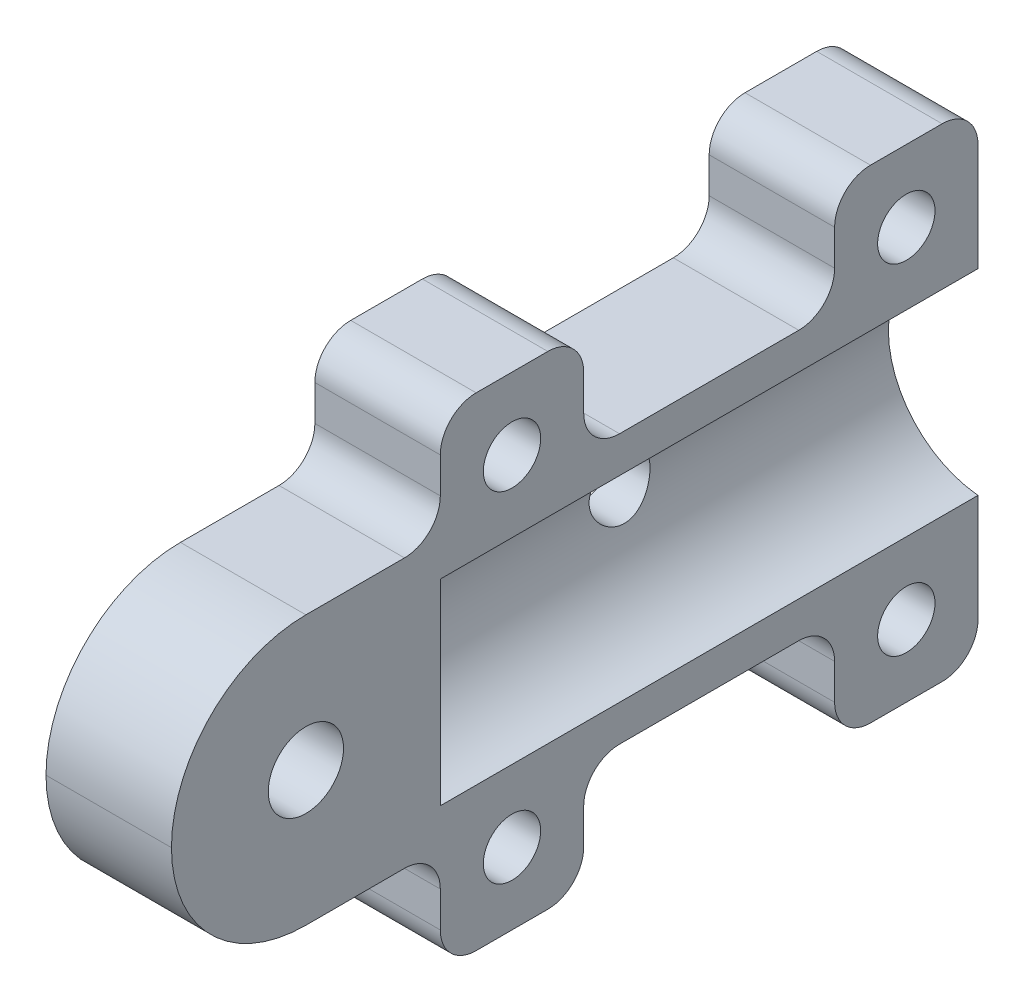
from build123d import *

# Parameters (mm, degrees)
SKETCH_1_W          = 15
SKETCH_1_H          = 15
SKETCH_1_R          = 5.5
EXTRUDE_1_DEPTH     = 45
SKETCH_5_W          = 15
SKETCH_5_H          = 15
EXTRUDE_3_DEPTH     = 15
FILLET_2_R          = 7.5
SKETCH_6_R          = 2.1
CUT_EXTRUDE_1_DEPTH = 49.023431781
CUT_EXTRUDE_2_DEPTH = 8
SKETCH_9_W          = 8
SKETCH_9_H          = 8
SKETCH_9_R          = 1.6
EXTRUDE_4_DEPTH     = 7
FILLET_3_R          = 2
SKETCH_11_R         = 3.2
CUT_EXTRUDE_3_DEPTH = 3.75
SKETCH_12_R         = 1.7
CUT_EXTRUDE_4_DEPTH = 10


with BuildPart() as part:
    # ｽｹｯﾁ1 → ﾎﾞｽ - 押し出し1 (new body)
    with BuildSketch(Plane.XY):
        Rectangle(SKETCH_1_W, SKETCH_1_H)
        with Locations(Location((0, 0, 0), (0, 0, 180))):
            Circle(SKETCH_1_R, mode=Mode.SUBTRACT)
    extrude(amount=EXTRUDE_1_DEPTH)

    # ｽｹｯﾁ5 → ﾎﾞｽ - 押し出し3 (add)
    with BuildSketch(Plane.XY.offset(45)):
        Rectangle(SKETCH_5_W, SKETCH_5_H)
    extrude(amount=-EXTRUDE_3_DEPTH)

    # ﾌｨﾚｯﾄ2
    fillet_2_edges = [part.edges().sort_by_distance(p)[0] for p in [
        (0, -7.5, 45),
        (0, 7.5, 45),
    ]]
    fillet(fillet_2_edges, radius=FILLET_2_R - 0.0001)  # a hair under: the kernel refuses the full size

    # ｽｹｯﾁ6 → ｶｯﾄ - 押し出し1 (cut, through all)
    with BuildSketch(Plane(origin=(7.5, 0, 0), x_dir=(0, 0, -1), z_dir=(1, 0, 0))):
        with Locations((-37.5, 0)):
            Circle(SKETCH_6_R)
    extrude(amount=-CUT_EXTRUDE_1_DEPTH, mode=Mode.SUBTRACT)

    # ｽｹｯﾁ7 → ｶｯﾄ - 押し出し2 (cut)
    with BuildSketch(Plane(origin=(7.5, 0, 0), x_dir=(0, 0, -1), z_dir=(1, 0, 0))):
        with BuildLine():
            Line((-37.5, -9.5), (2, -9.5))
            Line((2, -9.5), (2, 9.5))
            Line((2, 9.5), (-37.5, 9.5))
            ThreePointArc((-37.5, 9.5), (-44.217514421, 6.717514421), (-47, 0))
            ThreePointArc((-47, 0), (-44.217514421, -6.717514421), (-37.5, -9.5))
        make_face()
    extrude(amount=-CUT_EXTRUDE_2_DEPTH, mode=Mode.SUBTRACT)

    # ｽｹｯﾁ9 → ﾎﾞｽ - 押し出し4 (add)
    # profile 1 of 4: a face of its own
    with BuildSketch(Plane(origin=(-0.5, 0, 0), x_dir=(0, 0, -1), z_dir=(1, 0, 0))):
        with Locations((-4, -9.477225575)):
            Rectangle(SKETCH_9_W, SKETCH_9_H)
        with Locations((-4, -9.477225575)):
            Circle(SKETCH_9_R, mode=Mode.SUBTRACT)
    # profile 2 of 4: a face of its own
    with BuildSketch(Plane(origin=(-0.5, 0, 0), x_dir=(0, 0, -1), z_dir=(1, 0, 0))):
        with Locations((-26, 9.477225575)):
            Rectangle(SKETCH_9_W, SKETCH_9_H)
        with Locations((-26, 9.477225575)):
            Circle(SKETCH_9_R, mode=Mode.SUBTRACT)
    # profile 3 of 4: a face of its own
    with BuildSketch(Plane(origin=(-0.5, 0, 0), x_dir=(0, 0, -1), z_dir=(1, 0, 0))):
        with Locations((-4, 9.477225575)):
            Rectangle(SKETCH_9_W, SKETCH_9_H)
        with Locations((-4, 9.477225575)):
            Circle(SKETCH_9_R, mode=Mode.SUBTRACT)
    # profile 4 of 4: a face of its own
    with BuildSketch(Plane(origin=(-0.5, 0, 0), x_dir=(0, 0, -1), z_dir=(1, 0, 0))):
        with Locations((-26, -9.477225575)):
            Rectangle(SKETCH_9_W, SKETCH_9_H)
        with Locations((-26, -9.477225575)):
            Circle(SKETCH_9_R, mode=Mode.SUBTRACT)
    extrude(amount=-EXTRUDE_4_DEPTH)

    # ﾌｨﾚｯﾄ3
    fillet_3_edges = [part.edges().sort_by_distance(p)[0] for p in [
        (-4, 13.477225575, 22),
        (-4, 7.5, 30),
        (-4, 13.477225575, 30),
        (-4, 7.5, 22),
        (-4, 13.477225575, 0),
        (-4, 7.5, 8),
        (-4, 13.477225575, 8),
        (-4, -13.477225575, 30),
        (-4, -7.5, 22),
        (-4, -13.477225575, 22),
        (-4, -7.5, 30),
        (-4, -13.477225575, 8),
        (-4, -13.477225575, 0),
        (-4, -7.5, 8),
    ]]
    fillet(fillet_3_edges, radius=FILLET_3_R)

    # ｽｹｯﾁ11 → ｶｯﾄ - 押し出し3 (cut)
    with BuildSketch(Plane.ZY.offset(7.5)):
        with Locations((4, 9.477225575)):
            Circle(SKETCH_11_R)
        with Locations((26, 9.477225575)):
            Circle(SKETCH_11_R)
        with Locations((26, -9.477225575)):
            Circle(SKETCH_11_R)
        with Locations((4, -9.477225575)):
            Circle(SKETCH_11_R)
    extrude(amount=-CUT_EXTRUDE_3_DEPTH, mode=Mode.SUBTRACT)

    # ｽｹｯﾁ12 → ｶｯﾄ - 押し出し4 (cut)
    with BuildSketch(Plane.ZY.offset(7.5)):
        with Locations((15, 0)):
            Circle(SKETCH_12_R)
    extrude(amount=-CUT_EXTRUDE_4_DEPTH, mode=Mode.SUBTRACT)


solid = part.part
